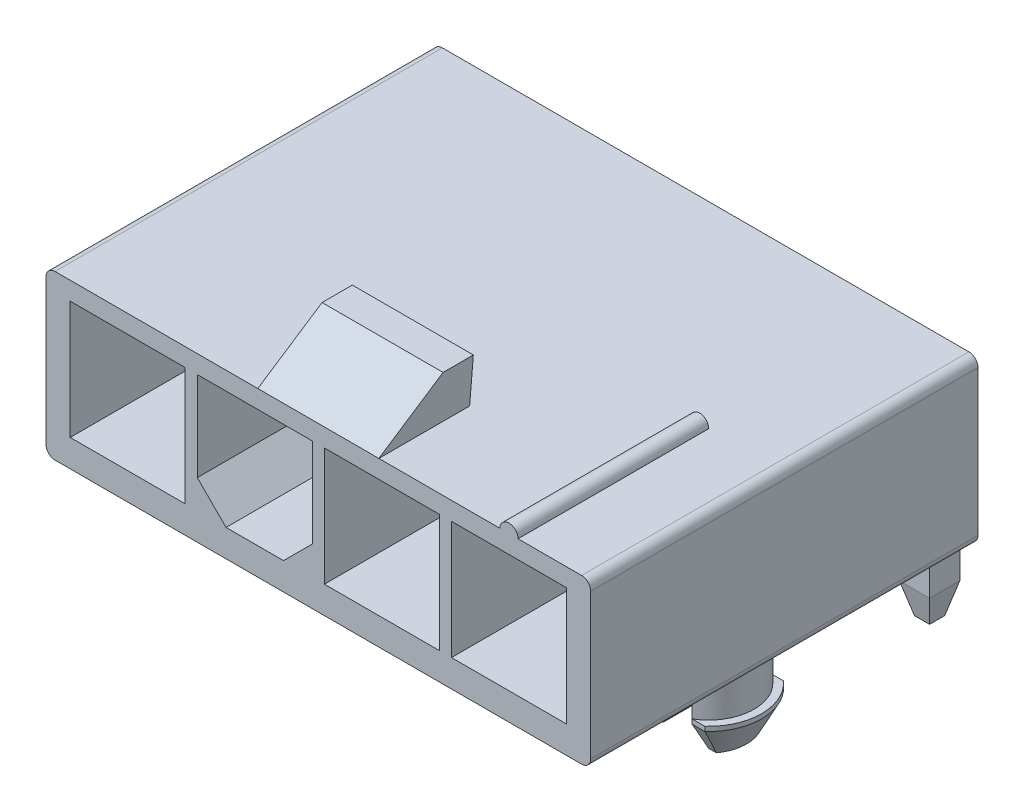
from build123d import *
from OCP.BRepAlgoAPI import BRepAlgoAPI_Cut
from OCP.TopTools import TopTools_ListOfShape
from OCP.BRepFilletAPI import BRepFilletAPI_MakeChamfer
from build123d.topology import SkipClean

# Parameters (mm, degrees)
CUT_EXTRUDE1_START      = -9.13
CUT_EXTRUDE1_OUTLINE_W  = 15.6
CUT_EXTRUDE1_OUTLINE_H  = 7.899038106
CUT_EXTRUDE1_DEPTH      = 8.98
CUT_EXTRUDE1_START_2    = -1.93
CUT_EXTRUDE1_2_DEPTH    = 2.9
CUT_EXTRUDE1_START_3    = -8.05
CUT_EXTRUDE1_3_DEPTH    = 16.099992307
CUT_EXTRUDE2_DEPTH      = 2
CUT_EXTRUDE3_START      = -1.78
CUT_EXTRUDE3_DEPTH      = 1.78
CUT_EXTRUDE4_DEPTH      = 2
CUT_EXTRUDE5_START      = -0.4
CUT_EXTRUDE5_DEPTH      = 0.4
CUT_EXTRUDE6_START      = -1.93
CUT_EXTRUDE6_DEPTH      = 1.93
CUT_EXTRUDE7_START      = -1.93
CUT_EXTRUDE7_DEPTH      = 1.93
CUT_EXTRUDE8_DEPTH      = 0.42260394
CUT_EXTRUDE9_DEPTH      = 0.42260394
CUT_EXTRUDE10_DEPTH     = 1.499999582
CUT_EXTRUDE11_DEPTH     = 1.5
BOSS_EXTRUDE1_DEPTH     = 1.2
BOSS_EXTRUDE2_DEPTH     = 1.2
CUT_EXTRUDE12_DEPTH     = 1.78
CUT_EXTRUDE13_DEPTH     = 1.5
CUT_EXTRUDE14_START     = -0.15
CUT_EXTRUDE14_DEPTH     = 0.15
CUT_EXTRUDE15_DEPTH     = 2.18
CUT_EXTRUDE16_START     = -1.93
CUT_EXTRUDE16_DEPTH     = 1.93
CUT_EXTRUDE17_DEPTH     = 1.78
SKETCH20_W              = 18
SKETCH20_H              = 4.899038106
CUT_EXTRUDE18_DEPTH     = 1.4
CUT_EXTRUDE19_START     = -1.78
CUT_EXTRUDE19_DEPTH     = 1.78
CUT_EXTRUDE20_DEPTH     = 1.500000418
CUT_EXTRUDE21_DEPTH     = 2.18
CUT_EXTRUDE22_DEPTH     = 7
CUT_EXTRUDE23_DEPTH     = 7
BOSS_EXTRUDE3_DEPTH     = 4.900961894
SKETCH27_W              = 1
SKETCH27_H              = 1
BOSS_EXTRUDE4_DEPTH     = 1.6
SKETCH28_W              = 1
SKETCH28_H              = 1
BOSS_EXTRUDE5_DEPTH     = 6.3
SKETCH29_W              = 1
SKETCH29_H              = 1
BOSS_EXTRUDE6_DEPTH     = 1.6
SKETCH30_W              = 1
SKETCH30_H              = 1
BOSS_EXTRUDE7_DEPTH     = 6.3
SKETCH31_W              = 1
SKETCH31_H              = 1
BOSS_EXTRUDE8_DEPTH     = 1.6
SKETCH32_W              = 1
SKETCH32_H              = 1
BOSS_EXTRUDE9_DEPTH     = 6.3
SKETCH33_W              = 1
SKETCH33_H              = 1
BOSS_EXTRUDE10_DEPTH    = 1.6
SKETCH34_W              = 1
SKETCH34_H              = 1
BOSS_EXTRUDE11_DEPTH    = 6.3
BOSS_EXTRUDE12_DEPTH    = 6.3
SKETCH36_W              = 3.8
SKETCH36_H              = 3.9
CUT_EXTRUDE24_DEPTH     = 9.1
SKETCH37_W              = 1
SKETCH37_H              = 1
BOSS_EXTRUDE13_DEPTH    = 3
SKETCH38_W              = 3.8
SKETCH38_H              = 3.9
CUT_EXTRUDE25_DEPTH     = 9.1
SKETCH39_W              = 1
SKETCH39_H              = 1
BOSS_EXTRUDE14_DEPTH    = 3
SKETCH40_W              = 3.8
SKETCH40_H              = 3.9
CUT_EXTRUDE26_DEPTH     = 9.1
SKETCH41_W              = 1
SKETCH41_H              = 1
BOSS_EXTRUDE15_DEPTH    = 3
SKETCH42_W              = 3.8
SKETCH42_H              = 3.9
CUT_EXTRUDE27_DEPTH     = 9.1
SKETCH43_W              = 1
SKETCH43_H              = 1
BOSS_EXTRUDE16_DEPTH    = 3
DRAFT1_ANGLE            = -5
CHAMFER1_SIZE           = 0.95
CHAMFER2_SIZE           = 0.25
CHAMFER2_SIZE2          = 1
FILLET1_R               = 0.3
FILLET2_R               = 1.3
CROQUIS1_R              = 1.45
SALIENTE_EXTRUIR1_DEPTH = 0.1


with BuildPart() as part:
    # Cut-Extrude1: read off the stored shape, not the designer's step
    # Cut-Extrude1 outline → Cut-Extrude1 (new body)
    with BuildSketch(Plane.XZ.offset(1.93).offset(CUT_EXTRUDE1_START)):
        with Locations((0, -3.949519053)):
            Rectangle(CUT_EXTRUDE1_OUTLINE_W, CUT_EXTRUDE1_OUTLINE_H)
    extrude(amount=CUT_EXTRUDE1_DEPTH)

    # Cut-Extrude1 2 outline → Cut-Extrude1 2 (add)
    with BuildSketch(Plane.XZ.offset(1.93).offset(CUT_EXTRUDE1_START_2)):
        with BuildLine():
            Line((-5.12739605, 0), (-7.8, 0))
            Line((-7.8, 0), (-7.8, -5.698612181))
            ThreePointArc((-7.8, -5.698612181), (-8.05, -6.6), (-7.8, -7.501387819))
            Line((-7.8, -7.501387819), (-7.8, -7.899038106))
            Line((-7.8, -7.899038106), (-5.12739606, -7.899038106))
            ThreePointArc((-5.12739606, -7.899038106), (-4.550000105, -6.600000244), (-5.12739605, -5.300962377))
            Line((-5.12739605, -5.300962377), (-5.12739605, 0))
        make_face()
        with BuildLine():
            Line((7.8, 0), (5.12739606, 0))
            Line((5.12739606, 0), (5.12739606, -5.300961894))
            ThreePointArc((5.12739606, -5.300961894), (4.55, -6.6), (5.12739606, -7.899038106))
            Line((5.12739606, -7.899038106), (7.8, -7.899038106))
            Line((7.8, -7.899038106), (7.8, -7.501387819))
            ThreePointArc((7.8, -7.501387819), (8.05, -6.6), (7.8, -5.698612181))
            Line((7.8, -5.698612181), (7.8, 0))
        make_face()
    extrude(amount=CUT_EXTRUDE1_2_DEPTH)

    # Cut-Extrude1 3 outline → Cut-Extrude1 3 (cut)
    with BuildSketch(Plane.YZ.offset(CUT_EXTRUDE1_START_3)):
        Polygon((-1.93, -5.300961894), (-1.93, 0), (-2.9, 0), (-2.9, -5.85), align=None)
        Polygon((7.2, 0), (5.8, 0), (7.2, -2.122484129), align=None)
        Polygon((-1.93, -7.899038106), (-2.9, -7.35), (-2.9, -7.899038106), align=None)
    extrude(amount=CUT_EXTRUDE1_3_DEPTH, mode=Mode.SUBTRACT)

    # Cut-Extrude1 4 outline → Cut-Extrude1 4 (revolve, cut)
    with BuildSketch(Plane(origin=(6.3, 0, -6.6), x_dir=(1, 0, 0), z_dir=(0, 0, 1))):
        Polygon((1.984313483, -1.93), (1.75, -1.93), (1.25, -2.9), (1.984313483, -2.9), align=None)
    revolve(axis=Axis((6.3, 0, -6.6), (0, 1, 0)), mode=Mode.SUBTRACT)

    # Cut-Extrude1 5 outline → Cut-Extrude1 5 (revolve, cut)
    with BuildSketch(Plane(origin=(-6.3, 0, -6.6), x_dir=(1, 0, 0), z_dir=(0, 0, 1))):
        Polygon((1.984313483, -1.93), (1.75, -1.93), (1.25, -2.9), (1.984313483, -2.9), align=None)
    revolve(axis=Axis((-6.3, 0, -6.6), (0, 1, 0)), mode=Mode.SUBTRACT)


with BuildPart() as cut_extrude2_tool:
    # Sketch2 → Cut-Extrude2 (new body)
    with BuildSketch(Plane.XY):
        with BuildLine():
            Line((-5.127396478, -1.78), (-7.8, -1.78))
            add(Edge.make_bspline(
                [(-7.8, -1.93), (-7.8, -1.88), (-7.8, -1.83), (-7.8, -1.78)],
                knots=[0, 0, 0, 0, 1, 1, 1, 1], degree=3))
            Line((-7.8, -1.93), (-7.05, -1.93))
            add(Edge.make_bspline(
                [(-5.550000418, -1.93), (-6.050000279, -1.93), (-6.550000139, -1.93), (-7.05, -1.93)],
                knots=[0, 0, 0, 0, 1, 1, 1, 1], degree=3))
            add(Edge.make_bspline(
                [(-5.127396478, -1.93), (-5.268264458, -1.93), (-5.409132438, -1.93), (-5.550000418, -1.93)],
                knots=[0, 0, 0, 0, 1, 1, 1, 1], degree=3))
            add(Edge.make_bspline(
                [(-5.127396478, -1.93), (-5.127396478, -1.88), (-5.127396478, -1.83), (-5.127396478, -1.78)],
                knots=[0, 0, 0, 0, 1, 1, 1, 1], degree=3))
        make_face()
    extrude(amount=-CUT_EXTRUDE2_DEPTH)


with BuildPart() as part_1:
    add(part.part)

    # Cut-Extrude2: cut by cut_extrude2_tool, with a tolerance
    cut_extrude2_stock = TopTools_ListOfShape()
    cut_extrude2_stock.Append(part_1.part.wrapped)
    cut_extrude2_tools = TopTools_ListOfShape()
    cut_extrude2_tools.Append(cut_extrude2_tool.part.wrapped)
    cut_extrude2_cut = BRepAlgoAPI_Cut()
    cut_extrude2_cut.SetArguments(cut_extrude2_stock)
    cut_extrude2_cut.SetTools(cut_extrude2_tools)
    cut_extrude2_cut.SetFuzzyValue(0.00001)
    cut_extrude2_cut.Build()
    add(Compound.cast(cut_extrude2_cut.Shape()).solids(), mode=Mode.REPLACE)

    # Sketch3 → Cut-Extrude3 (cut)
    with BuildSketch(Plane.XZ.offset(1.78).offset(CUT_EXTRUDE3_START)):
        with BuildLine():
            Line((5.127395632, -5.300961894), (5.127395632, 0))
            Line((5.127395632, 0), (-7.8, 0))
            Line((-7.8, 0), (-7.8, -2))
            Line((-7.8, -2), (-5.127396478, -2))
            Line((-5.127396478, -2), (-5.127396478, -5.300962377))
            ThreePointArc((-5.127396478, -5.300962377), (-4.550000533, -6.600000244), (-5.127396488, -7.899038106))
            Line((-5.127396488, -7.899038106), (5.127395632, -7.899038106))
            ThreePointArc((5.127395632, -7.899038106), (4.549999572, -6.6), (5.127395632, -5.300961894))
        make_face()
    extrude(amount=CUT_EXTRUDE3_DEPTH, mode=Mode.SUBTRACT)


with BuildPart() as cut_extrude4_tool:
    # Sketch4 → Cut-Extrude4 (new body)
    with BuildSketch(Plane.XY):
        with BuildLine():
            Line((7.8, 0), (5.12739606, 0))
            add(Edge.make_bspline(
                [(5.12739606, -1.78), (5.12739606, -1.186666667), (5.12739606, -0.593333333), (5.12739606, 0)],
                knots=[0, 0, 0, 0, 1, 1, 1, 1], degree=3))
            add(Edge.make_bspline(
                [(5.12739606, -1.93), (5.12739606, -1.88), (5.12739606, -1.83), (5.12739606, -1.78)],
                knots=[0, 0, 0, 0, 1, 1, 1, 1], degree=3))
            add(Edge.make_bspline(
                [(5.12739606, -1.93), (5.26826404, -1.93), (5.40913202, -1.93), (5.55, -1.93)],
                knots=[0, 0, 0, 0, 1, 1, 1, 1], degree=3))
            add(Edge.make_bspline(
                [(5.55, -1.93), (6.05, -1.93), (6.55, -1.93), (7.05, -1.93)],
                knots=[0, 0, 0, 0, 1, 1, 1, 1], degree=3))
            Line((7.05, -1.93), (7.8, -1.93))
            add(Edge.make_bspline(
                [(7.8, -1.93), (7.8, -1.88), (7.8, -1.83), (7.8, -1.78)],
                knots=[0, 0, 0, 0, 1, 1, 1, 1], degree=3))
            add(Edge.make_bspline(
                [(7.8, -1.78), (7.8, -1.186666667), (7.8, -0.593333333), (7.8, 0)],
                knots=[0, 0, 0, 0, 1, 1, 1, 1], degree=3))
        make_face()
    extrude(amount=-CUT_EXTRUDE4_DEPTH)


with BuildPart() as part_2:
    add(part_1.part)

    # Cut-Extrude4: cut by cut_extrude4_tool, with a tolerance
    cut_extrude4_stock = TopTools_ListOfShape()
    cut_extrude4_stock.Append(part_2.part.wrapped)
    cut_extrude4_tools = TopTools_ListOfShape()
    cut_extrude4_tools.Append(cut_extrude4_tool.part.wrapped)
    cut_extrude4_cut = BRepAlgoAPI_Cut()
    cut_extrude4_cut.SetArguments(cut_extrude4_stock)
    cut_extrude4_cut.SetTools(cut_extrude4_tools)
    cut_extrude4_cut.SetFuzzyValue(0.00001)
    cut_extrude4_cut.Build()
    add(Compound.cast(cut_extrude4_cut.Shape()).solids(), mode=Mode.REPLACE)

    # Sketch5 → Cut-Extrude5 (cut)
    with BuildSketch(Plane.XZ.offset(CUT_EXTRUDE5_START)):
        with BuildLine():
            Line((-7.8, -2), (-5.127396478, -2))
            Line((-5.127396478, -2), (-5.127396478, -5.300962377))
            ThreePointArc((-5.127396478, -5.300962377), (-4.550000533, -6.600000244), (-5.127396488, -7.899038106))
            Line((-5.127396488, -7.899038106), (5.127395632, -7.899038106))
            ThreePointArc((5.127395632, -7.899038106), (4.549999572, -6.6), (5.127395632, -5.300961894))
            Line((5.127395632, -5.300961894), (5.127395632, -2))
            Line((5.127395632, -2), (7.8, -2))
            Line((7.8, -2), (7.8, 0))
            Line((7.8, 0), (-7.8, 0))
            Line((-7.8, 0), (-7.8, -2))
        make_face()
    extrude(amount=CUT_EXTRUDE5_DEPTH, mode=Mode.SUBTRACT)

    # Sketch6 → Cut-Extrude6 (cut)
    with BuildSketch(Plane.XZ.offset(1.93).offset(CUT_EXTRUDE6_START)):
        with BuildLine():
            Line((-7.8, -7.501387819), (-7.8, -7.899038106))
            Line((-7.8, -7.899038106), (-7.47260394, -7.899038106))
            ThreePointArc((-7.47260394, -7.899038106), (-7.651012358, -7.712324416), (-7.8, -7.501387819))
        make_face()
    extrude(amount=CUT_EXTRUDE6_DEPTH, mode=Mode.SUBTRACT)

    # Sketch7 → Cut-Extrude7 (cut)
    with BuildSketch(Plane.XZ.offset(1.93).offset(CUT_EXTRUDE7_START)):
        with BuildLine():
            Line((7.47260394, -7.899038106), (7.8, -7.899038106))
            Line((7.8, -7.899038106), (7.8, -7.501387819))
            ThreePointArc((7.8, -7.501387819), (7.651012358, -7.712324416), (7.47260394, -7.899038106))
        make_face()
    extrude(amount=CUT_EXTRUDE7_DEPTH, mode=Mode.SUBTRACT)

    # Sketch8 → Cut-Extrude8 (cut)
    with BuildSketch(Plane(origin=(-5.12739605, 0, 0), x_dir=(0, 0, -1), z_dir=(1, 0, 0))):
        with BuildLine():
            Line((2, -1.93), (5.300961894, -1.93))
            Line((5.300961894, -1.93), (5.300961894, 0.4))
            Line((5.300961894, 0.4), (2, 0.4))
            Line((2, 0.4), (2, 0))
            add(Edge.make_bspline(
                [(2, -1.93), (2, -1.286666667), (2, -0.643333333), (2, 0)],
                knots=[0, 0, 0, 0, 1, 1, 1, 1], degree=3))
        make_face()
    extrude(amount=-CUT_EXTRUDE8_DEPTH, mode=Mode.SUBTRACT)


with BuildPart() as cut_extrude9_tool:
    # Sketch9 → Cut-Extrude9 (new body)
    with BuildSketch(Plane.ZY.offset(-5.12739606)):
        with BuildLine():
            Line((-2, 0.4), (-5.300961894, 0.4))
            Line((-5.300961894, 0.4), (-5.300961894, -1.93))
            Line((-5.300961894, -1.93), (-2, -1.93))
            add(Edge.make_bspline(
                [(-2, -1.93), (-2, -1.88), (-2, -1.83), (-2, -1.78)],
                knots=[0, 0, 0, 0, 1, 1, 1, 1], degree=3))
            add(Edge.make_bspline(
                [(-2, -1.78), (-2, -1.186666667), (-2, -0.593333333), (-2, 0)],
                knots=[0, 0, 0, 0, 1, 1, 1, 1], degree=3))
            Line((-2, 0), (-2, 0.4))
        make_face()
    extrude(amount=-CUT_EXTRUDE9_DEPTH)


with BuildPart() as part_3:
    add(part_2.part)

    # Cut-Extrude9: cut by cut_extrude9_tool, with a tolerance
    cut_extrude9_stock = TopTools_ListOfShape()
    cut_extrude9_stock.Append(part_3.part.wrapped)
    cut_extrude9_tools = TopTools_ListOfShape()
    cut_extrude9_tools.Append(cut_extrude9_tool.part.wrapped)
    cut_extrude9_cut = BRepAlgoAPI_Cut()
    cut_extrude9_cut.SetArguments(cut_extrude9_stock)
    cut_extrude9_cut.SetTools(cut_extrude9_tools)
    cut_extrude9_cut.SetFuzzyValue(0.00001)
    cut_extrude9_cut.Build()
    add(Compound.cast(cut_extrude9_cut.Shape()).solids(), mode=Mode.REPLACE)

    # Sketch10 → Cut-Extrude10 (cut)
    with SkipClean():  # the faces are left unmerged after this step: merging them gives an invalid solid
        with BuildSketch(Plane(origin=(-5.54999999, 0, 0), x_dir=(0, 0, -1), z_dir=(1, 0, 0))):
            with BuildLine():
                Line((1.999999719, -1.93000068), (5.300961613, -1.93000068))
                Line((5.300961613, -1.93000068), (5.300961613, 0.39999932))
                Line((5.300961613, 0.39999932), (1.999999719, 0.39999932))
                Line((1.999999719, 0.39999932), (1.999999719, -6.8e-07))
                add(Edge.make_bspline(
                    [(1.999999719, -1.93000068), (1.999999719, -1.286667346), (1.999999719, -0.643334013), (1.999999719, -6.8e-07)],
                    knots=[0, 0, 0, 0, 1, 1, 1, 1], degree=3))
            make_face()
        extrude(amount=-CUT_EXTRUDE10_DEPTH, mode=Mode.SUBTRACT)

    # Sketch11 → Cut-Extrude11 (cut)
    with SkipClean():  # the faces are left unmerged after this step: merging them gives an invalid solid
        with BuildSketch(Plane.ZY.offset(-5.55)):
            with BuildLine():
                Line((-2, 0.4), (-5.300961894, 0.4))
                Line((-5.300961894, 0.4), (-5.300961894, -1.93))
                Line((-5.300961894, -1.93), (-2, -1.93))
                add(Edge.make_bspline(
                    [(-2, -1.93), (-2, -1.88), (-2, -1.83), (-2, -1.78)],
                    knots=[0, 0, 0, 0, 1, 1, 1, 1], degree=3))
                add(Edge.make_bspline(
                    [(-2, -1.78), (-2, -1.186666667), (-2, -0.593333333), (-2, 0)],
                    knots=[0, 0, 0, 0, 1, 1, 1, 1], degree=3))
                Line((-2, 0), (-2, 0.4))
            make_face()
        extrude(amount=-CUT_EXTRUDE11_DEPTH, mode=Mode.SUBTRACT)

    # Sketch12 → Boss-Extrude1 (add)
    with SkipClean():  # the faces are left unmerged after this step: merging them gives an invalid solid
        with BuildSketch(Plane(origin=(7.8, 0, 0), x_dir=(0, 0, -1), z_dir=(1, 0, 0))):
            Polygon((7.899038106, 0.4), (0, 0.4), (0, 5.8), (2.122484129, 7.2), (7.899038106, 7.2), align=None)
        extrude(amount=BOSS_EXTRUDE1_DEPTH)

    # Sketch13 → Boss-Extrude2 (add)
    with SkipClean():  # the faces are left unmerged after this step: merging them gives an invalid solid
        with BuildSketch(Plane.ZY.offset(7.8)):
            Polygon((-7.899038106, 7.2), (-2.122484129, 7.2), (0, 5.8), (0, 0.4), (-7.899038106, 0.4), align=None)
        extrude(amount=BOSS_EXTRUDE2_DEPTH)

    # Sketch14 → Cut-Extrude12 (cut)
    with SkipClean():  # the faces are left unmerged after this step: merging them gives an invalid solid
        with BuildSketch(Plane(origin=(0, 0, 0), x_dir=(-1, 0, 0), z_dir=(0, 1, 0))):
            with BuildLine():
                Line((-7.8, -6.6), (-7.8, -5.698612181))
                ThreePointArc((-7.8, -5.698612181), (-8.030945267, -6.857543167), (-7.47260394, -7.899038106))
                Line((-7.47260394, -7.899038106), (-7.05, -7.899038106))
                ThreePointArc((-7.05, -7.899038106), (-7.599038106, -7.35), (-7.8, -6.6))
            make_face()
        extrude(amount=-CUT_EXTRUDE12_DEPTH, mode=Mode.SUBTRACT)

    # Sketch15 → Cut-Extrude13 (cut)
    with SkipClean():  # the faces are left unmerged after this step: merging them gives an invalid solid
        with BuildSketch(Plane(origin=(-7.05, 0, 0), x_dir=(0, -1, 0), z_dir=(-1, 0, 0))):
            Polygon((2.9, -5.85), (1.93, -5.300961894), (-0.4, -5.300961894), (-0.4, -7.899038106), (1.93, -7.899038106), (2.9, -7.35), align=None)
        extrude(amount=-CUT_EXTRUDE13_DEPTH, mode=Mode.SUBTRACT)

    # Sketch16 → Cut-Extrude14 (cut)
    with SkipClean():  # the faces are left unmerged after this step: merging them gives an invalid solid
        with BuildSketch(Plane.XZ.offset(1.93).offset(CUT_EXTRUDE14_START)):
            with BuildLine():
                Line((7.05, -5.300961894), (7.47260394, -5.300961894))
                ThreePointArc((7.47260394, -5.300961894), (7.651012358, -5.487675584), (7.8, -5.698612181))
                Line((7.8, -5.698612181), (7.8, -2))
                Line((7.8, -2), (7.05, -2))
                Line((7.05, -2), (7.05, -5.300961894))
            make_face()
        extrude(amount=CUT_EXTRUDE14_DEPTH, mode=Mode.SUBTRACT)

    # Sketch17 → Cut-Extrude15 (cut)
    with SkipClean():  # the faces are left unmerged after this step: merging them gives an invalid solid
        with BuildSketch(Plane(origin=(0, 0.4, 0), x_dir=(1, 0, 0), z_dir=(0, 1, 0))):
            with BuildLine():
                Line((-5.549999582, 5.300962136), (-5.127395793, 5.300962136))
                ThreePointArc((-5.127395793, 5.300962136), (-4.55, 6.60000018), (-5.12739606, 7.899038106))
                Line((-5.12739606, 7.899038106), (-5.55, 7.899038106))
                ThreePointArc((-5.55, 7.899038106), (-4.8, 6.600000241), (-5.549999582, 5.300962136))
            make_face()
        extrude(amount=-CUT_EXTRUDE15_DEPTH, mode=Mode.SUBTRACT)

    # Sketch18 → Cut-Extrude16 (cut)
    with SkipClean():  # the faces are left unmerged after this step: merging them gives an invalid solid
        with BuildSketch(Plane.XZ.offset(1.93).offset(CUT_EXTRUDE16_START)):
            with BuildLine():
                Line((-7.47260394, -5.300961894), (-7.05, -5.300961894))
                Line((-7.05, -5.300961894), (-7.05, -2))
                Line((-7.05, -2), (-7.8, -2))
                Line((-7.8, -2), (-7.8, -5.698612181))
                ThreePointArc((-7.8, -5.698612181), (-7.651012358, -5.487675584), (-7.47260394, -5.300961894))
            make_face()
        extrude(amount=CUT_EXTRUDE16_DEPTH, mode=Mode.SUBTRACT)

    # Sketch19 → Cut-Extrude17 (cut)
    with SkipClean():  # the faces are left unmerged after this step: merging them gives an invalid solid
        with BuildSketch(Plane(origin=(0, 0, 0), x_dir=(-1, 0, 0), z_dir=(0, 1, 0))):
            with BuildLine():
                Line((7.05, -7.899038106), (7.47260394, -7.899038106))
                ThreePointArc((7.47260394, -7.899038106), (8.05, -6.6), (7.47260394, -5.300961894))
                Line((7.47260394, -5.300961894), (7.05, -5.300961894))
                ThreePointArc((7.05, -5.300961894), (7.8, -6.6), (7.05, -7.899038106))
            make_face()
        extrude(amount=-CUT_EXTRUDE17_DEPTH, mode=Mode.SUBTRACT)

    # Sketch20 → Cut-Extrude18 (cut)
    with SkipClean():  # the faces are left unmerged after this step: merging them gives an invalid solid
        with BuildSketch(Plane(origin=(0, 7.2, 0), x_dir=(-1, 0, 0), z_dir=(0, 1, 0))):
            with Locations((0, -5.449519053)):
                Rectangle(SKETCH20_W, SKETCH20_H)
        extrude(amount=-CUT_EXTRUDE18_DEPTH, mode=Mode.SUBTRACT)

    # Sketch21 → Cut-Extrude19 (cut)
    with SkipClean():  # the faces are left unmerged after this step: merging them gives an invalid solid
        with BuildSketch(Plane.XZ.offset(1.78).offset(CUT_EXTRUDE19_START)):
            with BuildLine():
                Line((7.05, -2), (7.05, -5.300961894))
                ThreePointArc((7.05, -5.300961894), (7.599038106, -5.85), (7.8, -6.6))
                Line((7.8, -6.6), (7.8, -2))
                Line((7.8, -2), (7.05, -2))
            make_face()
        extrude(amount=CUT_EXTRUDE19_DEPTH, mode=Mode.SUBTRACT)

    # Sketch22 → Cut-Extrude20 (cut)
    with SkipClean():  # the faces are left unmerged after this step: merging them gives an invalid solid
        with BuildSketch(Plane(origin=(7.05, 0, 0), x_dir=(0, 0, -1), z_dir=(1, 0, 0))):
            Polygon((7.899038106, -1.93), (7.899038106, 0.4), (5.300961894, 0.4), (5.300961894, -1.93), (5.85, -2.9), (7.35, -2.9), align=None)
        extrude(amount=-CUT_EXTRUDE20_DEPTH, mode=Mode.SUBTRACT)

    # Sketch23 → Cut-Extrude21 (cut)
    with SkipClean():  # the faces are left unmerged after this step: merging them gives an invalid solid
        with BuildSketch(Plane(origin=(0, 0.4, 0), x_dir=(1, 0, 0), z_dir=(0, 1, 0))):
            with BuildLine():
                Line((5.12739606, 5.300961894), (5.55, 5.300961894))
                ThreePointArc((5.55, 5.300961894), (4.8, 6.599999759), (5.549999582, 7.899037864))
                Line((5.549999582, 7.899037864), (5.127395793, 7.899037864))
                ThreePointArc((5.127395793, 7.899037864), (4.55, 6.59999982), (5.12739606, 5.300961894))
            make_face()
        extrude(amount=-CUT_EXTRUDE21_DEPTH, mode=Mode.SUBTRACT)

    # Sketch24 → Cut-Extrude22 (cut)
    with SkipClean():  # the faces are left unmerged after this step: merging them gives an invalid solid
        with BuildSketch(Plane(origin=(9, 0, 0), x_dir=(0, 0, -1), z_dir=(1, 0, 0))):
            Polygon((2.122484129, 7.2), (0, 5.8), (3, 5.8), (3, 7.2), align=None)
        extrude(amount=-CUT_EXTRUDE22_DEPTH, mode=Mode.SUBTRACT)

    # Sketch25 → Cut-Extrude23 (cut)
    with SkipClean():  # the faces are left unmerged after this step: merging them gives an invalid solid
        with BuildSketch(Plane.ZY.offset(9)):
            Polygon((-2.122484129, 7.2), (-3, 7.2), (-3, 5.8), (0, 5.8), align=None)
        extrude(amount=-CUT_EXTRUDE23_DEPTH, mode=Mode.SUBTRACT)

    # Sketch26 → Boss-Extrude3 (add)
    with SkipClean():  # the faces are left unmerged after this step: merging them gives an invalid solid
        with BuildSketch(Plane(origin=(0, 0, -7.899038106), x_dir=(-1, 0, 0), z_dir=(0, 0, -1))):
            Polygon((7.8, 0.4), (7.8, 0), (7.05, 0), (7.05, 0.4), (-7.05, 0.4), (-7.05, 0), (-7.8, 0), (-7.8, 0.4), (-9, 0.4), (-9, 5.8), (9, 5.8), (9, 0.4), align=None)
        extrude(amount=BOSS_EXTRUDE3_DEPTH)

    # Sketch27 → Boss-Extrude4 (add)
    with SkipClean():  # the faces are left unmerged after this step: merging them gives an invalid solid
        with BuildSketch(Plane(origin=(0, 0, -12.8), x_dir=(-1, 0, 0), z_dir=(0, 0, -1))):
            with Locations((-6.3, 3.3)):
                Rectangle(SKETCH27_W, SKETCH27_H)
        extrude(amount=BOSS_EXTRUDE4_DEPTH)

    # Sketch28 → Boss-Extrude5 (add)
    with SkipClean():  # the faces are left unmerged after this step: merging them gives an invalid solid
        with BuildSketch(Plane.XZ.offset(-2.8)):
            with Locations((6.3, -13.9)):
                Rectangle(SKETCH28_W, SKETCH28_H)
        extrude(amount=BOSS_EXTRUDE5_DEPTH)

    # Sketch29 → Boss-Extrude6 (add)
    with SkipClean():  # the faces are left unmerged after this step: merging them gives an invalid solid
        with BuildSketch(Plane(origin=(0, 0, -12.8), x_dir=(-1, 0, 0), z_dir=(0, 0, -1))):
            with Locations((-2.1, 3.3)):
                Rectangle(SKETCH29_W, SKETCH29_H)
        extrude(amount=BOSS_EXTRUDE6_DEPTH)

    # Sketch30 → Boss-Extrude7 (add)
    with SkipClean():  # the faces are left unmerged after this step: merging them gives an invalid solid
        with BuildSketch(Plane.XZ.offset(-2.8)):
            with Locations((2.1, -13.9)):
                Rectangle(SKETCH30_W, SKETCH30_H)
        extrude(amount=BOSS_EXTRUDE7_DEPTH)

    # Sketch31 → Boss-Extrude8 (add)
    with SkipClean():  # the faces are left unmerged after this step: merging them gives an invalid solid
        with BuildSketch(Plane(origin=(0, 0, -12.8), x_dir=(-1, 0, 0), z_dir=(0, 0, -1))):
            with Locations((2.1, 3.3)):
                Rectangle(SKETCH31_W, SKETCH31_H)
        extrude(amount=BOSS_EXTRUDE8_DEPTH)

    # Sketch32 → Boss-Extrude9 (add)
    with SkipClean():  # the faces are left unmerged after this step: merging them gives an invalid solid
        with BuildSketch(Plane.XZ.offset(-2.8)):
            with Locations((-2.1, -13.9)):
                Rectangle(SKETCH32_W, SKETCH32_H)
        extrude(amount=BOSS_EXTRUDE9_DEPTH)

    # Sketch33 → Boss-Extrude10 (add)
    with SkipClean():  # the faces are left unmerged after this step: merging them gives an invalid solid
        with BuildSketch(Plane(origin=(0, 0, -12.8), x_dir=(-1, 0, 0), z_dir=(0, 0, -1))):
            with Locations((6.3, 3.3)):
                Rectangle(SKETCH33_W, SKETCH33_H)
        extrude(amount=BOSS_EXTRUDE10_DEPTH)

    # Sketch34 → Boss-Extrude11 (add)
    with SkipClean():  # the faces are left unmerged after this step: merging them gives an invalid solid
        with BuildSketch(Plane.XZ.offset(-2.8)):
            with Locations((-6.3, -13.9)):
                Rectangle(SKETCH34_W, SKETCH34_H)
        extrude(amount=BOSS_EXTRUDE11_DEPTH)

    # Sketch35 → Boss-Extrude12 (add)
    with SkipClean():  # the faces are left unmerged after this step: merging them gives an invalid solid
        with BuildSketch(Plane.XY):
            with BuildLine():
                Line((6, 5.8), (6.6, 5.8))
                ThreePointArc((6.6, 5.8), (6.3, 6.1), (6, 5.8))
            make_face()
        extrude(amount=-BOSS_EXTRUDE12_DEPTH)

    # Sketch36 → Cut-Extrude24 (cut)
    with SkipClean():  # the faces are left unmerged after this step: merging them gives an invalid solid
        with BuildSketch(Plane.XY):
            with Locations((6.3, 3.25)):
                Rectangle(SKETCH36_W, SKETCH36_H)
        extrude(amount=-CUT_EXTRUDE24_DEPTH, mode=Mode.SUBTRACT)

    # Sketch37 → Boss-Extrude13 (add)
    with SkipClean():  # the faces are left unmerged after this step: merging them gives an invalid solid
        with BuildSketch(Plane.XY.offset(-9.1)):
            with Locations((6.3, 3.3)):
                Rectangle(SKETCH37_W, SKETCH37_H)
        extrude(amount=BOSS_EXTRUDE13_DEPTH)

    # Sketch38 → Cut-Extrude25 (cut)
    with SkipClean():  # the faces are left unmerged after this step: merging them gives an invalid solid
        with BuildSketch(Plane.XY):
            with Locations((2.1, 3.25)):
                Rectangle(SKETCH38_W, SKETCH38_H)
        extrude(amount=-CUT_EXTRUDE25_DEPTH, mode=Mode.SUBTRACT)

    # Sketch39 → Boss-Extrude14 (add)
    with SkipClean():  # the faces are left unmerged after this step: merging them gives an invalid solid
        with BuildSketch(Plane.XY.offset(-9.1)):
            with Locations((2.1, 3.3)):
                Rectangle(SKETCH39_W, SKETCH39_H)
        extrude(amount=BOSS_EXTRUDE14_DEPTH)

    # Sketch40 → Cut-Extrude26 (cut)
    with SkipClean():  # the faces are left unmerged after this step: merging them gives an invalid solid
        with BuildSketch(Plane.XY):
            with Locations((-6.3, 3.25)):
                Rectangle(SKETCH40_W, SKETCH40_H)
        extrude(amount=-CUT_EXTRUDE26_DEPTH, mode=Mode.SUBTRACT)

    # Sketch41 → Boss-Extrude15 (add)
    with SkipClean():  # the faces are left unmerged after this step: merging them gives an invalid solid
        with BuildSketch(Plane.XY.offset(-9.1)):
            with Locations((-6.3, 3.3)):
                Rectangle(SKETCH41_W, SKETCH41_H)
        extrude(amount=BOSS_EXTRUDE15_DEPTH)

    # Sketch42 → Cut-Extrude27 (cut)
    with SkipClean():  # the faces are left unmerged after this step: merging them gives an invalid solid
        with BuildSketch(Plane.XY):
            with Locations((-2.1, 3.25)):
                Rectangle(SKETCH42_W, SKETCH42_H)
        extrude(amount=-CUT_EXTRUDE27_DEPTH, mode=Mode.SUBTRACT)

    # Sketch43 → Boss-Extrude16 (add)
    with SkipClean():  # the faces are left unmerged after this step: merging them gives an invalid solid
        with BuildSketch(Plane.XY.offset(-9.1)):
            with Locations((-2.1, 3.3)):
                Rectangle(SKETCH43_W, SKETCH43_H)
        extrude(amount=BOSS_EXTRUDE16_DEPTH)

    # Draft1
    draft1_faces = [part_3.faces().sort_by_distance(p)[0] for p in [
        (0, 6.5, -3),
    ]]
    draft(draft1_faces, Plane.ZX.offset(5.8), DRAFT1_ANGLE)

    # Chamfer1
    chamfer1_edges = [part_3.edges().sort_by_distance(p)[0] for p in [
        (-0.2, 1.3, -4.55),
        (-4, 1.3, -4.55),
    ]]
    chamfer(chamfer1_edges, length=CHAMFER1_SIZE)

    # Chamfer2: one chamfer whose edges measure the first distance from different faces: ONE call of the kernel's chamfer builder (chamfer() names one face for all edges)
    chamfer2_edges_1 = [part_3.edges().sort_by_distance(p)[0] for p in [
        (6.3, -3.5, -14.4),
        (6.8, -3.5, -13.9),
        (6.3, -3.5, -13.4),
        (5.8, -3.5, -13.9),
    ]]
    chamfer2_side_1 = [part_3.faces().sort_by_distance(p)[0] for p in [
        (6.3, -3.5, -13.9),
    ]]
    chamfer2_edges_2 = [part_3.edges().sort_by_distance(p)[0] for p in [
        (2.1, -3.5, -14.4),
        (2.6, -3.5, -13.9),
        (2.1, -3.5, -13.4),
        (1.6, -3.5, -13.9),
    ]]
    chamfer2_side_2 = [part_3.faces().sort_by_distance(p)[0] for p in [
        (2.1, -3.5, -13.9),
    ]]
    chamfer2_edges_3 = [part_3.edges().sort_by_distance(p)[0] for p in [
        (-2.1, -3.5, -14.4),
        (-1.6, -3.5, -13.9),
        (-2.1, -3.5, -13.4),
        (-2.6, -3.5, -13.9),
    ]]
    chamfer2_side_3 = [part_3.faces().sort_by_distance(p)[0] for p in [
        (-2.1, -3.5, -13.9),
    ]]
    chamfer2_edges_4 = [part_3.edges().sort_by_distance(p)[0] for p in [
        (-6.3, -3.5, -13.4),
        (-6.8, -3.5, -13.9),
        (-6.3, -3.5, -14.4),
        (-5.8, -3.5, -13.9),
    ]]
    chamfer2_side_4 = [part_3.faces().sort_by_distance(p)[0] for p in [
        (-6.3, -3.5, -13.9),
    ]]
    chamfer2_edges_5 = [part_3.edges().sort_by_distance(p)[0] for p in [
        (6.3, 3.8, -6.1),
        (5.8, 3.3, -6.1),
        (6.3, 2.8, -6.1),
        (6.8, 3.3, -6.1),
    ]]
    chamfer2_side_5 = [part_3.faces().sort_by_distance(p)[0] for p in [
        (6.3, 3.3, -6.1),
    ]]
    chamfer2_edges_6 = [part_3.edges().sort_by_distance(p)[0] for p in [
        (2.1, 3.8, -6.1),
        (1.6, 3.3, -6.1),
        (2.1, 2.8, -6.1),
        (2.6, 3.3, -6.1),
    ]]
    chamfer2_side_6 = [part_3.faces().sort_by_distance(p)[0] for p in [
        (2.1, 3.3, -6.1),
    ]]
    chamfer2_edges_7 = [part_3.edges().sort_by_distance(p)[0] for p in [
        (-6.3, 3.8, -6.1),
        (-6.8, 3.3, -6.1),
        (-6.3, 2.8, -6.1),
        (-5.8, 3.3, -6.1),
    ]]
    chamfer2_side_7 = [part_3.faces().sort_by_distance(p)[0] for p in [
        (-6.3, 3.3, -6.1),
    ]]
    chamfer2_edges_8 = [part_3.edges().sort_by_distance(p)[0] for p in [
        (-2.1, 3.8, -6.1),
        (-2.6, 3.3, -6.1),
        (-2.1, 2.8, -6.1),
        (-1.6, 3.3, -6.1),
    ]]
    chamfer2_side_8 = [part_3.faces().sort_by_distance(p)[0] for p in [
        (-2.1, 3.3, -6.1),
    ]]
    chamfer2 = BRepFilletAPI_MakeChamfer(part_3.part.solid().wrapped)
    for e in chamfer2_edges_1:
        chamfer2.Add(CHAMFER2_SIZE, CHAMFER2_SIZE2, e.wrapped, chamfer2_side_1[0].wrapped)  # the first distance lies on this face
    for e in chamfer2_edges_2:
        chamfer2.Add(CHAMFER2_SIZE, CHAMFER2_SIZE2, e.wrapped, chamfer2_side_2[0].wrapped)  # the first distance lies on this face
    for e in chamfer2_edges_3:
        chamfer2.Add(CHAMFER2_SIZE, CHAMFER2_SIZE2, e.wrapped, chamfer2_side_3[0].wrapped)  # the first distance lies on this face
    for e in chamfer2_edges_4:
        chamfer2.Add(CHAMFER2_SIZE, CHAMFER2_SIZE2, e.wrapped, chamfer2_side_4[0].wrapped)  # the first distance lies on this face
    for e in chamfer2_edges_5:
        chamfer2.Add(CHAMFER2_SIZE, CHAMFER2_SIZE2, e.wrapped, chamfer2_side_5[0].wrapped)  # the first distance lies on this face
    for e in chamfer2_edges_6:
        chamfer2.Add(CHAMFER2_SIZE, CHAMFER2_SIZE2, e.wrapped, chamfer2_side_6[0].wrapped)  # the first distance lies on this face
    for e in chamfer2_edges_7:
        chamfer2.Add(CHAMFER2_SIZE, CHAMFER2_SIZE2, e.wrapped, chamfer2_side_7[0].wrapped)  # the first distance lies on this face
    for e in chamfer2_edges_8:
        chamfer2.Add(CHAMFER2_SIZE, CHAMFER2_SIZE2, e.wrapped, chamfer2_side_8[0].wrapped)  # the first distance lies on this face
    add(Compound.cast(chamfer2.Shape()), mode=Mode.REPLACE)

    # Fillet1
    fillet1_edges = [part_3.edges().sort_by_distance(p)[0] for p in [
        (9, 0.4, -3.949519053),
        (-9, 0.4, -3.949519053),
        (-9, 5.8, -5.449519053),
        (9, 5.8, -5.449519053),
        (6.3, 2.8, -13.4),
        (2.1, 2.8, -13.4),
        (-2.1, 2.8, -13.4),
        (-6.3, 2.8, -13.4),
    ]]
    fillet(fillet1_edges, radius=FILLET1_R)

    # Fillet2
    # the kernel refuses this fillet: 1.3 mm, written as the material it takes off along each edge
    with BuildSketch(Plane(origin=(10.05, 3.8, -14.4), x_dir=(0, 0, 1), z_dir=(-1, 0, 0)), Plane(origin=(5.85, 3.8, -14.4), x_dir=(0, 0, 1), z_dir=(-1, 0, 0)), Plane(origin=(1.65, 3.8, -14.4), x_dir=(0, 0, 1), z_dir=(-1, 0, 0)), Plane(origin=(-2.55, 3.8, -14.4), x_dir=(0, 0, 1), z_dir=(-1, 0, 0))) as fillet2_piece_1:
        with BuildLine():
            CenterArc((FILLET2_R, -FILLET2_R), FILLET2_R, 90, 90)
            Line((0, -FILLET2_R), (0, 0))
            Line((0, 0), (FILLET2_R, 0))
        make_face()
    extrude(amount=7.5, mode=Mode.SUBTRACT)

    # Croquis1 → Saliente-Extruir1 (add)
    with SkipClean():  # the faces are left unmerged after this step: merging them gives an invalid solid
        with BuildSketch(Plane.XZ.offset(-0.4)):
            with Locations((-6.25, -6.6)):
                Circle(CROQUIS1_R)
            with Locations((6.25, -6.6)):
                Circle(CROQUIS1_R)
        extrude(amount=SALIENTE_EXTRUIR1_DEPTH)


solid = part_3.part
